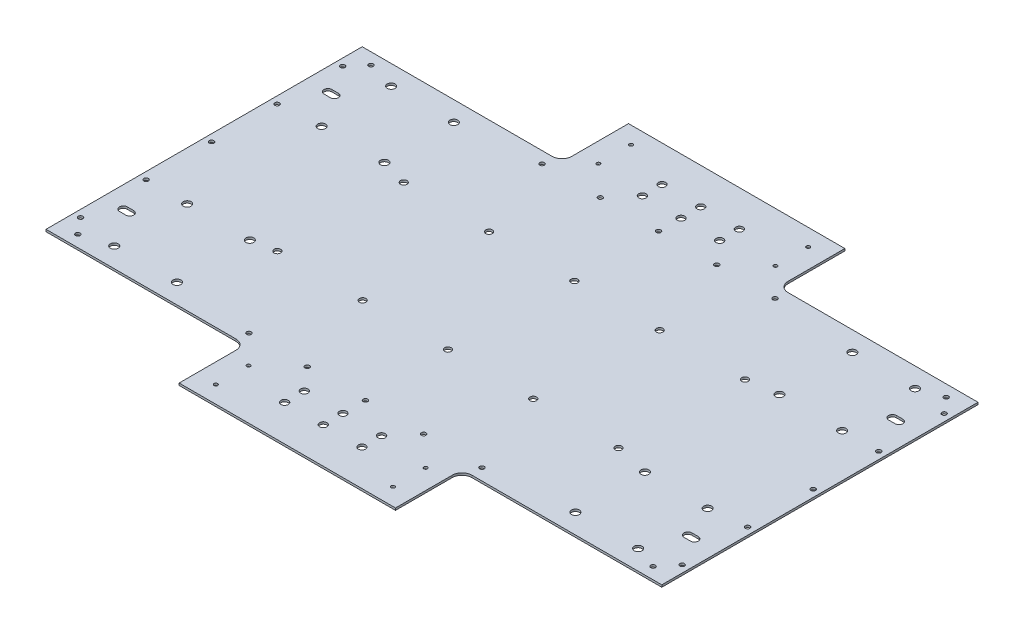
from build123d import *

# Parameters (mm, degrees)
BOSS_EXTRUDE2_DEPTH   = 3.26
SKETCH4_R             = 5
CUT_EXTRUDE7_DEPTH    = 10
SKETCH5_R             = 6
BEARING_HOLES_DEPTH   = 3.26
SKETCH7_R             = 3.5
CUT_EXTRUDE3_DEPTH    = 3.26
FRONT_HOLES_R         = 3.5
FRONT_HOLES_FET_DEPTH = 3.26
SKETCH10_R            = 3.500000002
SKETCH10_R_2          = 3.5
CUT_EXTRUDE5_DEPTH    = 3.26
CUT_EXTRUDE6_DEPTH    = 3.26
FILLET1_R             = 15
SKETCH13_R            = 5.588
CUT_EXTRUDE8_DEPTH    = 10
SKETCH14_R            = 2.75
CUT_EXTRUDE9_DEPTH    = 10


with BuildPart() as part:
    # Sketch1 → Boss-Extrude2 (new body)
    with BuildSketch(Plane(origin=(0, 0, 0), x_dir=(1, 0, 0), z_dir=(0, 1, 0))):
        Polygon((-165.1, 241.3), (-469.9, 241.3), (-469.9, -241.3), (-165.1, -241.3), (-165.1, -342.9), (165.1, -342.9), (165.1, -241.3), (469.9, -241.3), (469.9, 241.3), (165.1, 241.3), (165.1, 342.9), (-165.1, 342.9), align=None)
    extrude(amount=BOSS_EXTRUDE2_DEPTH)

    # Sketch4 → Cut-Extrude7 (cut)
    with BuildSketch(Plane(origin=(0, 3.26, 0), x_dir=(1, 0, 0), z_dir=(0, 1, 0))):
        with Locations(Location((-258.748000001, 93.5555, 0), (0, 0, 270))):
            Circle(SKETCH4_R)
        with Locations(Location((-128.573000001, 93.5555, 0), (0, 0, 270))):
            Circle(SKETCH4_R)
        with Locations(Location((1.601999999, 93.5555, 0), (0, 0, 270))):
            Circle(SKETCH4_R)
        with Locations(Location((131.776999999, 93.5555, 0), (0, 0, 270))):
            Circle(SKETCH4_R)
        with Locations(Location((261.951999999, 93.5555, 0), (0, 0, 270))):
            Circle(SKETCH4_R)
        with Locations(Location((256.172918992, -93.5555, 0), (0, 0, 270))):
            Circle(SKETCH4_R)
        with Locations(Location((125.997918992, -93.5555, 0), (0, 0, 270))):
            Circle(SKETCH4_R)
        with Locations(Location((-4.177081008, -93.5555, 0), (0, 0, 270))):
            Circle(SKETCH4_R)
        with Locations(Location((-134.352081008, -93.5555, 0), (0, 0, 270))):
            Circle(SKETCH4_R)
        with Locations(Location((-264.527081008, -93.5555, 0), (0, 0, 270))):
            Circle(SKETCH4_R)
    extrude(amount=-CUT_EXTRUDE7_DEPTH, mode=Mode.SUBTRACT)

    # Sketch5 → bearing holes (cut)
    with BuildSketch(Plane(origin=(0, 3.26, 0), x_dir=(1, 0, 0), z_dir=(0, 1, 0))):
        with Locations(Location((308.124918992, 211.3, 0), (0, 0, 270))):
            Circle(SKETCH5_R)
        with Locations(Location((403.824918992, 211.3, 0), (0, 0, 270))):
            Circle(SKETCH5_R)
        with Locations(Location((308.124918992, 100.0405, 0), (0, 0, 270))):
            Circle(SKETCH5_R)
        with Locations(Location((403.824918992, 100.0405, 0), (0, 0, 270))):
            Circle(SKETCH5_R)
        with Locations(Location((-395.7, -211.3, 0), (0, 0, 270))):
            Circle(SKETCH5_R)
        with Locations(Location((-300, -100.0405, 0), (0, 0, 270))):
            Circle(SKETCH5_R)
        with Locations(Location((-395.7, -100.0405, 0), (0, 0, 270))):
            Circle(SKETCH5_R)
        with Locations(Location((-300, -211.3, 0), (0, 0, 270))):
            Circle(SKETCH5_R)
        with Locations(Location((403.824918992, -105.2115, 0), (0, 0, 270))):
            Circle(SKETCH5_R)
        with Locations(Location((308.124918992, -105.2115, 0), (0, 0, 270))):
            Circle(SKETCH5_R)
        with Locations(Location((308.124918992, -211.3, 0), (0, 0, 270))):
            Circle(SKETCH5_R)
        with Locations(Location((403.824918992, -211.3, 0), (0, 0, 270))):
            Circle(SKETCH5_R)
        with Locations(Location((-300, 211.3, 0), (0, 0, 270))):
            Circle(SKETCH5_R)
        with Locations(Location((-395.7, 105.2115, 0), (0, 0, 270))):
            Circle(SKETCH5_R)
        with Locations(Location((-300, 105.2115, 0), (0, 0, 270))):
            Circle(SKETCH5_R)
        with Locations(Location((-395.7, 211.3, 0), (0, 0, 270))):
            Circle(SKETCH5_R)
    extrude(amount=-BEARING_HOLES_DEPTH, mode=Mode.SUBTRACT)

    # Sketch7 → Cut-Extrude3 (cut)
    with BuildSketch(Plane(origin=(0, 3.26, 0), x_dir=(1, 0, 0), z_dir=(0, 1, 0))):
        with Locations(Location((0, -223.64316, 0), (0, 0, 270))):
            Circle(SKETCH7_R)
        with Locations(Location((0, 223.64316, 0), (0, 0, 270))):
            Circle(SKETCH7_R)
        with Locations(Location((-88.9, -223.64316, 0), (0, 0, 270))):
            Circle(SKETCH7_R)
        with Locations(Location((-177.8, -223.64316, 0), (0, 0, 270))):
            Circle(SKETCH7_R)
        with Locations(Location((88.9, -223.64316, 0), (0, 0, 270))):
            Circle(SKETCH7_R)
        with Locations(Location((177.8, -223.64316, 0), (0, 0, 270))):
            Circle(SKETCH7_R)
        with Locations(Location((88.9, 223.64316, 0), (0, 0, 270))):
            Circle(SKETCH7_R)
        with Locations(Location((177.8, 223.64316, 0), (0, 0, 270))):
            Circle(SKETCH7_R)
        with Locations(Location((-88.9, 223.64316, 0), (0, 0, 270))):
            Circle(SKETCH7_R)
        with Locations(Location((-177.8, 223.64316, 0), (0, 0, 270))):
            Circle(SKETCH7_R)
    extrude(amount=-CUT_EXTRUDE3_DEPTH, mode=Mode.SUBTRACT)

    # front holes → front holes fet (cut)
    with BuildSketch(Plane(origin=(0, 3.26, 0), x_dir=(1, 0, 0), z_dir=(0, 1, 0))):
        with Locations(Location((459.075, 0.59516, 0), (0, 0, 270))):
            Circle(FRONT_HOLES_R)
        with Locations(Location((459.075, -99.40484, 0), (0, 0, 270))):
            Circle(FRONT_HOLES_R)
        with Locations(Location((459.075, -199.40484, 0), (0, 0, 270))):
            Circle(FRONT_HOLES_R)
        with Locations(Location((459.075, 100.59516, 0), (0, 0, 270))):
            Circle(FRONT_HOLES_R)
        with Locations(Location((459.075, 200.59516, 0), (0, 0, 270))):
            Circle(FRONT_HOLES_R)
        with Locations(Location((-459.075, 200.59516, 0), (0, 0, 270))):
            Circle(FRONT_HOLES_R)
        with Locations(Location((-459.075, 100.59516, 0), (0, 0, 270))):
            Circle(FRONT_HOLES_R)
        with Locations(Location((-459.075, -199.40484, 0), (0, 0, 270))):
            Circle(FRONT_HOLES_R)
        with Locations(Location((-459.075, -99.40484, 0), (0, 0, 270))):
            Circle(FRONT_HOLES_R)
        with Locations(Location((-459.075, 0.59516, 0), (0, 0, 270))):
            Circle(FRONT_HOLES_R)
    extrude(amount=-FRONT_HOLES_FET_DEPTH, mode=Mode.SUBTRACT)

    # Sketch10 → Cut-Extrude5 (cut)
    with BuildSketch(Plane(origin=(0, 3.26, 0), x_dir=(1, 0, 0), z_dir=(0, 1, 0))):
        with Locations(Location((-438.9, -223.64316, 0), (0, 0, 270))):
            Circle(SKETCH10_R)
        with Locations(Location((-438.9, 223.64316, 0), (0, 0, 270))):
            Circle(SKETCH10_R)
        with Locations(Location((438.9, 223.64316, 0), (0, 0, 270))):
            Circle(SKETCH10_R_2)
        with Locations(Location((438.9, -223.64316, 0), (0, 0, 270))):
            Circle(SKETCH10_R_2)
    extrude(amount=-CUT_EXTRUDE5_DEPTH, mode=Mode.SUBTRACT)

    # Sketch12 → Cut-Extrude6 (cut)
    with BuildSketch(Plane(origin=(0, 3.26, 0), x_dir=(1, 0, 0), z_dir=(0, 1, 0))):
        with BuildLine():
            Line((-426.702999083, 149.6355), (-436.550016189, 149.6355))
            ThreePointArc((-436.550016189, 149.6355), (-442.550016189, 155.6355), (-436.550016189, 161.6355))
            Line((-436.550016189, 161.6355), (-426.702999083, 161.6355))
            ThreePointArc((-426.702999083, 161.6355), (-420.702999083, 155.6355), (-426.702999083, 149.6355))
        make_face()
        with BuildLine():
            Line((-437.562081008, -149.6355), (-427.715063902, -149.6355))
            ThreePointArc((-427.715063902, -149.6355), (-421.715063902, -155.6355), (-427.715063902, -161.6355))
            Line((-427.715063902, -161.6355), (-437.562081008, -161.6355))
            ThreePointArc((-437.562081008, -161.6355), (-443.562081008, -155.6355), (-437.562081008, -149.6355))
        make_face()
        with BuildLine():
            Line((424.127918992, -149.6355), (433.974936098, -149.6355))
            ThreePointArc((433.974936098, -149.6355), (439.974936098, -155.6355), (433.974936098, -161.6355))
            Line((433.974936098, -161.6355), (424.127918992, -161.6355))
            ThreePointArc((424.127918992, -161.6355), (418.127918992, -155.6355), (424.127918992, -149.6355))
        make_face()
        with BuildLine():
            Line((434.987000917, 149.6355), (425.139983811, 149.6355))
            ThreePointArc((425.139983811, 149.6355), (419.139983811, 155.6355), (425.139983811, 161.6355))
            Line((425.139983811, 161.6355), (434.987000917, 161.6355))
            ThreePointArc((434.987000917, 161.6355), (440.987000917, 155.6355), (434.987000917, 149.6355))
        make_face()
    extrude(amount=-CUT_EXTRUDE6_DEPTH, mode=Mode.SUBTRACT)

    # Fillet1
    fillet1_edges = [part.edges().sort_by_distance(p)[0] for p in [
        (-165.1, 1.63, 241.3),
        (165.1, 1.63, 241.3),
        (165.1, 1.63, -241.3),
        (-165.1, 1.63, -241.3),
    ]]
    fillet(fillet1_edges, radius=FILLET1_R)

    # Sketch13 → Cut-Extrude8 (cut)
    with BuildSketch(Plane(origin=(0, 3.26, 0), x_dir=(1, 0, 0), z_dir=(0, 1, 0))):
        with Locations(Location((59, -258, 0), (0, 0, 270))):
            Circle(SKETCH13_R)
        with Locations(Location((0, -258, 0), (0, 0, 270))):
            Circle(SKETCH13_R)
        with Locations(Location((-59, -258, 0), (0, 0, 270))):
            Circle(SKETCH13_R)
        with Locations(Location((59, -288, 0), (0, 0, 270))):
            Circle(SKETCH13_R)
        with Locations(Location((0, -288, 0), (0, 0, 270))):
            Circle(SKETCH13_R)
        with Locations(Location((-59, -288, 0), (0, 0, 270))):
            Circle(SKETCH13_R)
        with Locations(Location((-59, 288, 0), (0, 0, 270))):
            Circle(SKETCH13_R)
        with Locations(Location((0, 288, 0), (0, 0, 270))):
            Circle(SKETCH13_R)
        with Locations(Location((59, 288, 0), (0, 0, 270))):
            Circle(SKETCH13_R)
        with Locations(Location((-59, 258, 0), (0, 0, 270))):
            Circle(SKETCH13_R)
        with Locations(Location((0, 258, 0), (0, 0, 270))):
            Circle(SKETCH13_R)
        with Locations(Location((59, 258, 0), (0, 0, 270))):
            Circle(SKETCH13_R)
    extrude(amount=-CUT_EXTRUDE8_DEPTH, mode=Mode.SUBTRACT)

    # Sketch14 → Cut-Extrude9 (cut)
    with BuildSketch(Plane(origin=(0, 3.26, 0), x_dir=(1, 0, 0), z_dir=(0, 1, 0))):
        with Locations(Location((135.1, 316.90316, 0), (0, 0, 270))):
            Circle(SKETCH14_R)
        with Locations(Location((135.1, 266.90316, 0), (0, 0, 270))):
            Circle(SKETCH14_R)
        with Locations(Location((-135.1, 266.90316, 0), (0, 0, 270))):
            Circle(SKETCH14_R)
        with Locations(Location((-135.1, 316.90316, 0), (0, 0, 270))):
            Circle(SKETCH14_R)
        with Locations(Location((135.1, -266.90316, 0), (0, 0, 270))):
            Circle(SKETCH14_R)
        with Locations(Location((135.1, -316.90316, 0), (0, 0, 270))):
            Circle(SKETCH14_R)
        with Locations(Location((-135.1, -316.90316, 0), (0, 0, 270))):
            Circle(SKETCH14_R)
        with Locations(Location((-135.1, -266.90316, 0), (0, 0, 270))):
            Circle(SKETCH14_R)
    extrude(amount=-CUT_EXTRUDE9_DEPTH, mode=Mode.SUBTRACT)


solid = part.part
